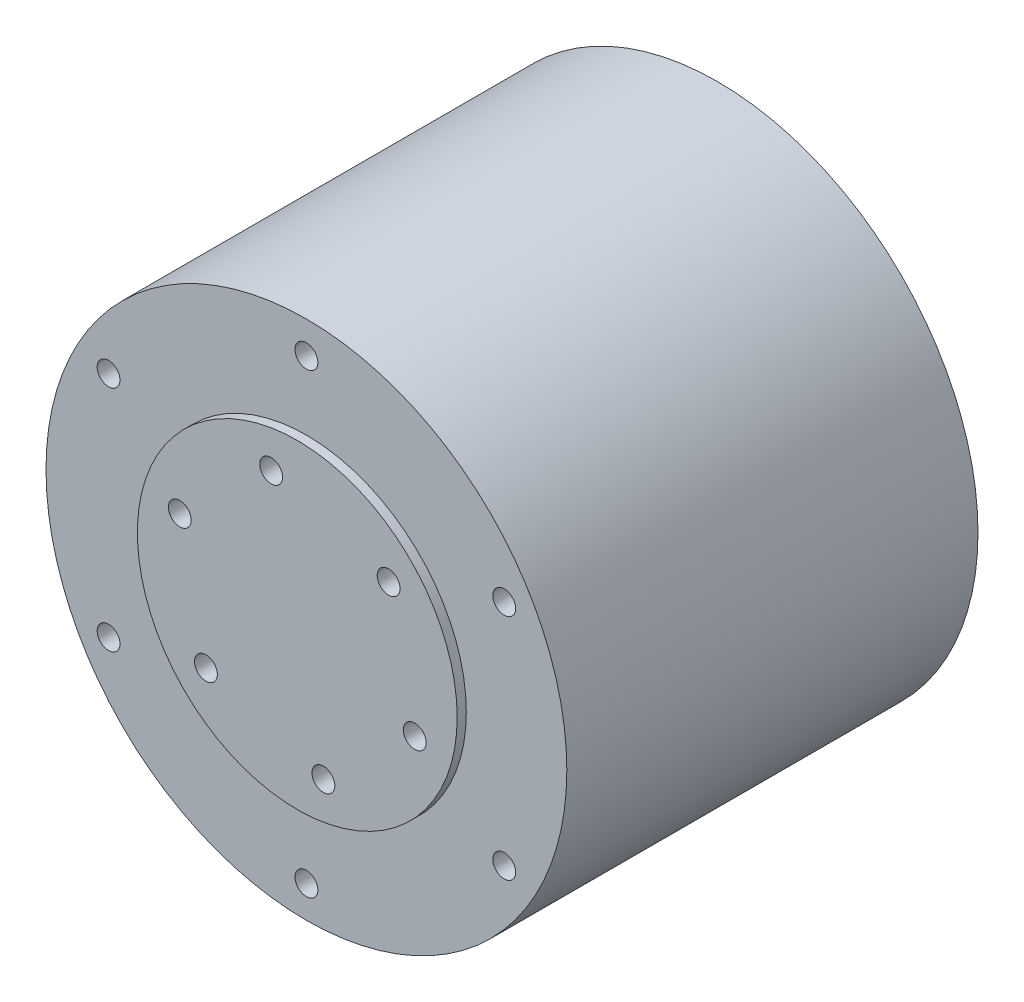
from build123d import *

# Parameters (mm, degrees)
SKETCH_1_R      = 28.5
EXTRUDE_1_DEPTH = 45
SKETCH_2_R      = 17.5
EXTRUDE_2_DEPTH = 1
M3X0_5_1_D      = 2.5
M3X0_5_1_DEPTH  = 4.248924226
M3X0_5_1_TIP    = 0.751075774
M3X0_5_2_D      = 2.5
M3X0_5_2_DEPTH  = 4.248924226
M3X0_5_2_TIP    = 0.751075774
M3X0_5_3_D      = 2.5
M3X0_5_3_DEPTH  = 4.248924226
M3X0_5_3_TIP    = 0.751075774


with BuildPart() as part:
    # 草图1 → 凸台-拉伸1 (new body)
    with BuildSketch(Plane.XY):
        Circle(SKETCH_1_R)
    extrude(amount=EXTRUDE_1_DEPTH)

    # 草图2 → 凸台-拉伸2 (add)
    with BuildSketch(Plane.XY.offset(45)):
        Circle(SKETCH_2_R)
    extrude(amount=EXTRUDE_2_DEPTH)

    # M3x0.5 螺纹孔1
    with Locations(Plane(origin=(0, 25, 45), x_dir=(1, 0, 0), z_dir=(0, 0, 1))):
        with Locations((0, 0), (21.650635095, -12.5), (21.650635095, -37.5), (0, -50), (-21.650635095, -37.5), (-21.650635095, -12.5)):
            Hole(M3X0_5_1_D / 2, depth=M3X0_5_1_DEPTH)
            with Locations((0, 0, -(M3X0_5_1_DEPTH + M3X0_5_1_TIP / 2))):  # 118° drill point
                Cone(0, M3X0_5_1_D / 2, M3X0_5_1_TIP, mode=Mode.SUBTRACT)

    # M3x0.5 螺纹孔2
    with Locations(Plane(origin=(-2.857682397, 13.194076372, 46), x_dir=(1, 0, 0), z_dir=(0, 0, 1))):
        with Locations((0, 0), (12.855246516, -4.122212634), (15.712928913, -17.316289006), (5.715364794, -26.388152744), (-7.139881722, -22.26594011), (-9.997564119, -9.071863738)):
            Hole(M3X0_5_2_D / 2, depth=M3X0_5_2_DEPTH)
            with Locations((0, 0, -(M3X0_5_2_DEPTH + M3X0_5_2_TIP / 2))):  # 118° drill point
                Cone(0, M3X0_5_2_D / 2, M3X0_5_2_TIP, mode=Mode.SUBTRACT)

    # M3x0.5 螺纹孔3
    with Locations(Plane(origin=(13.435028843, 13.435028843, 0), x_dir=(-1, 0, 0), z_dir=(0, 0, -1))):
        with Locations((0, 0), (0, -26.870057686), (26.870057686, -26.870057686), (26.870057686, 0)):
            Hole(M3X0_5_3_D / 2, depth=M3X0_5_3_DEPTH)
            with Locations((0, 0, -(M3X0_5_3_DEPTH + M3X0_5_3_TIP / 2))):  # 118° drill point
                Cone(0, M3X0_5_3_D / 2, M3X0_5_3_TIP, mode=Mode.SUBTRACT)


solid = part.part
